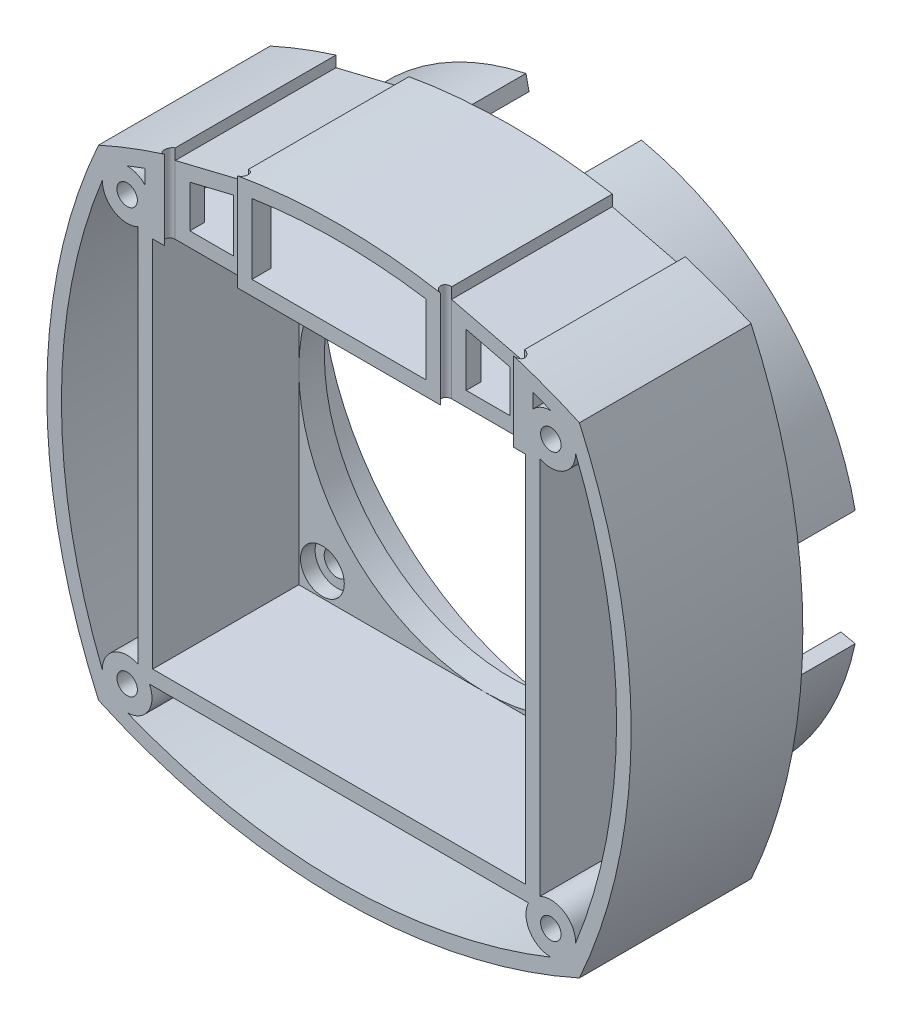
from build123d import *

# Parameters (mm, degrees)
EXTRUDE_1_DEPTH      = 23.5
SKETCH_4_R           = 25.5
CUT_EXTRUDE_1_DEPTH  = 3.5
SKETCH_5_W           = 51
SKETCH_5_H           = 51
CUT_EXTRUDE_2_DEPTH  = 20
SKETCH_7_R           = 3.000005628
SKETCH_7_R_2         = 3
CUT_EXTRUDE_4_DEPTH  = 2
SKETCH_8_R           = 1.75
CUT_EXTRUDE_5_DEPTH  = 2
SKETCH_10_R          = 1.4
CUT_EXTRUDE_6_DEPTH  = 8
EXTRUDE_2_DEPTH      = 10
CUT_EXTRUDE_7_DEPTH  = 56
CUT_EXTRUDE_START    = -26
CUT_EXTRUDE_8_DEPTH  = 26
SHELL_START          = -38
SHELL_1_OUTLINE_W    = 55
SHELL_1_OUTLINE_H    = 21.5
SHELL_1_DEPTH        = 10.5
SHELL_START_2        = 27.5
SHELL_1_2_DEPTH      = 8.20966081
SHELL_START_3        = 35.221916067
SHELL_1_3_DEPTH      = 2.778083933
SHELL_1_4_DEPTH      = 6.069092804
SHELL_START_4        = 2
SHELL_1_5_DEPTH      = 21.5
SHELL_1_6_DEPTH      = 11.5
SHELL_1_7_DEPTH      = 20
SHELL_START_5        = 13.5
SHELL_1_8_DEPTH      = 10
CUT_EXTRUDE_9_DEPTH  = 20
CUT_EXTRUDE_START_2  = -21.5
CUT_EXTRUDE_10_DEPTH = 21.5


with BuildPart() as part:
    # 草图3 → 凸台-拉伸1 (new body)
    with BuildSketch(Plane.XY):
        with BuildLine():
            ThreePointArc((32.915026221, 32.915026221), (0, 40), (-32.915026221, 32.915026221))
            ThreePointArc((-32.915026221, 32.915026221), (-40, 0), (-32.915026221, -32.915026221))
            ThreePointArc((-32.915026221, -32.915026221), (0, -40), (32.915026221, -32.915026221))
            ThreePointArc((32.915026221, -32.915026221), (40, 0), (32.915026221, 32.915026221))
        make_face()
    extrude(amount=EXTRUDE_1_DEPTH)

    # 草图4 → 切除-拉伸1 (cut)
    with BuildSketch(Plane(origin=(0, 0, 0), x_dir=(-1, 0, 0), z_dir=(0, 0, -1))):
        Circle(SKETCH_4_R)
    extrude(amount=-CUT_EXTRUDE_1_DEPTH, mode=Mode.SUBTRACT)

    # 草图5 → 切除-拉伸2 (cut)
    with BuildSketch(Plane.XY.offset(23.5)):
        Rectangle(SKETCH_5_W, SKETCH_5_H)
    extrude(amount=-CUT_EXTRUDE_2_DEPTH, mode=Mode.SUBTRACT)

    # 草图7 → 切除-拉伸4 (cut)
    with BuildSketch(Plane.XY.offset(3.5)):
        with Locations((22.273863607, -22.273863607)):
            Circle(SKETCH_7_R)
        with Locations((-22.273863607, -22.273863607)):
            Circle(SKETCH_7_R_2)
        with Locations((22.273863607, 22.273863607)):
            Circle(SKETCH_7_R_2)
        with Locations((-22.273863607, 22.273863607)):
            Circle(SKETCH_7_R_2)
    extrude(amount=-CUT_EXTRUDE_4_DEPTH, mode=Mode.SUBTRACT)

    # 草图8 → 切除-拉伸5 (cut)
    with BuildSketch(Plane.XY.offset(1.5)):
        with Locations((22.273863607, -22.273863607)):
            Circle(SKETCH_8_R)
        with Locations((-22.273863607, -22.273863607)):
            Circle(SKETCH_8_R)
        with Locations((22.273863607, 22.273863607)):
            Circle(SKETCH_8_R)
        with Locations((-22.273863607, 22.273863607)):
            Circle(SKETCH_8_R)
    extrude(amount=-CUT_EXTRUDE_5_DEPTH, mode=Mode.SUBTRACT)

    # 草图10 → 切除-拉伸6 (cut)
    with BuildSketch(Plane.XY.offset(23.5)):
        with Locations((29, -29)):
            Circle(SKETCH_10_R)
        with Locations((29, 29)):
            Circle(SKETCH_10_R)
        with Locations((-29, 29)):
            Circle(SKETCH_10_R)
        with Locations((-29, -29)):
            Circle(SKETCH_10_R)
    extrude(amount=-CUT_EXTRUDE_6_DEPTH, mode=Mode.SUBTRACT)

    # 草图11 → 凸台-拉伸2 (add)
    with BuildSketch(Plane(origin=(0, 0, 0), x_dir=(-1, 0, 0), z_dir=(0, 0, -1))):
        with BuildLine():
            Line((-7.900644251, 37.169608828), (-7.484820869, 35.213313626))
            ThreePointArc((-7.484820869, 35.213313626), (-25.455844123, 25.455844123), (-35.213313626, 7.484820869))
            Line((-35.213313626, 7.484820869), (-37.169608828, 7.900644251))
            ThreePointArc((-37.169608828, 7.900644251), (-26.870057685, 26.870057685), (-7.900644251, 37.169608828))
        make_face()
        with BuildLine():
            Line((7.900644251, 37.169608828), (7.484820869, 35.213313626))
            ThreePointArc((7.484820869, 35.213313626), (25.455844123, 25.455844123), (35.213313626, 7.484820869))
            Line((35.213313626, 7.484820869), (37.169608828, 7.900644251))
            ThreePointArc((37.169608828, 7.900644251), (26.870057685, 26.870057685), (7.900644251, 37.169608828))
        make_face()
        with BuildLine():
            Line((-35.213313626, -7.484820869), (-37.169608828, -7.900644251))
            ThreePointArc((-37.169608828, -7.900644251), (-26.870057685, -26.870057685), (-7.900644251, -37.169608828))
            Line((-7.900644251, -37.169608828), (-7.484820869, -35.213313626))
            ThreePointArc((-7.484820869, -35.213313626), (-25.455844123, -25.455844123), (-35.213313626, -7.484820869))
        make_face()
        with BuildLine():
            Line((7.484820869, -35.213313626), (7.900644251, -37.169608828))
            ThreePointArc((7.900644251, -37.169608828), (26.870057685, -26.870057685), (37.169608828, -7.900644251))
            Line((37.169608828, -7.900644251), (35.213313626, -7.484820869))
            ThreePointArc((35.213313626, -7.484820869), (25.455844123, -25.455844123), (7.484820869, -35.213313626))
        make_face()
    extrude(amount=EXTRUDE_2_DEPTH)

    # 草图12 → 切除-拉伸7 (cut)
    with BuildSketch(Plane(origin=(0, 0, 0), x_dir=(1, 0, 0), z_dir=(0, 1, 0))):
        with BuildLine():
            Line((-23.915026221, -23.5), (-13.915026221, -23.5))
            ThreePointArc((-13.915026221, -23.5), (-13.165026221, -22.75), (-13.915026221, -22))
            Line((-13.915026221, -22), (-23.915026221, -22))
            ThreePointArc((-23.915026221, -22), (-24.665026221, -22.75), (-23.915026221, -23.5))
        make_face()
        with BuildLine():
            Line((13.915026221, -23.5), (23.915026221, -23.5))
            ThreePointArc((23.915026221, -23.5), (24.665026221, -22.75), (23.915026221, -22))
            Line((23.915026221, -22), (13.915026221, -22))
            ThreePointArc((13.915026221, -22), (13.165026221, -22.75), (13.915026221, -23.5))
        make_face()
    extrude(amount=CUT_EXTRUDE_7_DEPTH, mode=Mode.SUBTRACT)

    # 草图13 → 切除-拉伸8 (cut)
    with BuildSketch(Plane.XY.offset(22).offset(CUT_EXTRUDE_START)):
        with BuildLine():
            Line((-23.915026221, 36.341807162), (-23.915026221, 34.841807162))
            Line((-23.915026221, 34.841807162), (-13.915026221, 37.280530877))
            Line((-13.915026221, 37.280530877), (-13.915026221, 38.780530877))
            ThreePointArc((-13.915026221, 38.780530877), (-18.954288704, 37.722165048), (-23.915026221, 36.341807162))
        make_face()
        with BuildLine():
            Line((13.915026221, 38.780530877), (13.915026221, 37.280530877))
            Line((13.915026221, 37.280530877), (23.915026221, 34.841807162))
            Line((23.915026221, 34.841807162), (23.915026221, 36.341807162))
            ThreePointArc((23.915026221, 36.341807162), (18.954288704, 37.722165048), (13.915026221, 38.780530877))
        make_face()
    extrude(amount=CUT_EXTRUDE_8_DEPTH, mode=Mode.SUBTRACT)

    # 抽壳1: read off the stored shape, not the designer's step
    # 抽壳1 outline → 抽壳1 (cut)
    with BuildSketch(Plane(origin=(0, 0, 0), x_dir=(1, 0, 0), z_dir=(0, 1, 0)).offset(SHELL_START)):
        with Locations((0, -12.75)):
            Rectangle(SHELL_1_OUTLINE_W, SHELL_1_OUTLINE_H)
    extrude(amount=SHELL_1_DEPTH, mode=Mode.SUBTRACT)

    # Shell 1 2 outline → Shell 1 2 (cut)
    with BuildSketch(Plane(origin=(0, 0, 0), x_dir=(1, 0, 0), z_dir=(0, 1, 0)).offset(SHELL_START_2)):
        with BuildLine():
            Line((-25.915026221, -2), (-25.915026221, -13.5))
            Line((-25.915026221, -13.5), (-25.915026221, -20.862541391))
            ThreePointArc((-25.915026221, -20.862541391), (-25.004059927, -20.224825632), (-23.915026221, -20))
            Line((-23.915026221, -20), (-13.915026221, -20))
            ThreePointArc((-13.915026221, -20), (-12.47888556, -20.40479212), (-11.465536479, -21.5))
            Line((-11.465536479, -21.5), (11.465536479, -21.5))
            ThreePointArc((11.465536479, -21.5), (12.47888556, -20.40479212), (13.915026221, -20))
            Line((13.915026221, -20), (23.915026221, -20))
            ThreePointArc((23.915026221, -20), (25.004059927, -20.224825632), (25.915026221, -20.862541391))
            Line((25.915026221, -20.862541391), (25.915026221, -13.5))
            Line((25.915026221, -13.5), (25.915026221, -2))
            Line((25.915026221, -2), (-25.915026221, -2))
        make_face()
    extrude(amount=SHELL_1_2_DEPTH, mode=Mode.SUBTRACT)

    # Shell 1 3 outline → Shell 1 3 (cut)
    with BuildSketch(Plane(origin=(0, 0, 0), x_dir=(1, 0, 0), z_dir=(0, 1, 0)).offset(SHELL_START_3)):
        with BuildLine():
            Line((11.915026221, -2), (-11.915026221, -2))
            Line((-11.915026221, -2), (-11.915026221, -20.862541391))
            ThreePointArc((-11.915026221, -20.862541391), (-11.667565852, -21.165253368), (-11.465536479, -21.5))
            Line((-11.465536479, -21.5), (11.465536479, -21.5))
            ThreePointArc((11.465536479, -21.5), (11.667565852, -21.165253368), (11.915026221, -20.862541391))
            Line((11.915026221, -20.862541391), (11.915026221, -2))
        make_face()
    extrude(amount=SHELL_1_3_DEPTH, mode=Mode.SUBTRACT)

    # Shell 1 4 outline → Shell 1 4 (cut)
    with BuildSketch(Plane(origin=(0, 0, 0), x_dir=(1, 0, 0), z_dir=(0, 1, 0)).offset(SHELL_START_2)):
        with BuildLine():
            Line((-25.915026221, -2), (-27.5, -2))
            Line((-27.5, -2), (-27.5, -23.5))
            Line((-27.5, -23.5), (-26.560777532, -23.5))
            ThreePointArc((-26.560777532, -23.5), (-26.586130541, -22.096010925), (-25.915026221, -20.862541391))
            Line((-25.915026221, -20.862541391), (-25.915026221, -2))
        make_face()
        with BuildLine():
            Line((27.5, -2), (25.915026221, -2))
            Line((25.915026221, -2), (25.915026221, -20.862541391))
            ThreePointArc((25.915026221, -20.862541391), (26.586130541, -22.096010925), (26.560777532, -23.5))
            Line((26.560777532, -23.5), (27.5, -23.5))
            Line((27.5, -23.5), (27.5, -2))
        make_face()
    extrude(amount=SHELL_1_4_DEPTH, mode=Mode.SUBTRACT)

    # Shell 1 5 outline → Shell 1 5 (cut)
    with BuildSketch(Plane.XY.offset(SHELL_START_4)):
        with BuildLine():
            Line((27.5, -32.051229261), (27.5, -32.991437854))
            ThreePointArc((27.5, -32.991437854), (28.262318347, -32.699665486), (29.02154168, -32.399931758))
            ThreePointArc((29.02154168, -32.399931758), (28.240488243, -32.314082361), (27.5, -32.051229261))
        make_face()
        with BuildLine():
            ThreePointArc((-29.02154168, -32.399931758), (-28.262318347, -32.699665486), (-27.5, -32.991437854))
            Line((-27.5, -32.991437854), (-27.5, -32.051229261))
            ThreePointArc((-27.5, -32.051229261), (-28.240488243, -32.314082361), (-29.02154168, -32.399931758))
        make_face()
        with BuildLine():
            ThreePointArc((27.5, -25.94877074), (30.806354197, -26.119533976), (32.399931758, -29.02154168))
            ThreePointArc((32.399931758, -29.02154168), (38, 0), (32.399931758, 29.02154168))
            ThreePointArc((32.399931758, 29.02154168), (30.806354197, 26.119533976), (27.5, 25.94877074))
            Line((27.5, 25.94877074), (27.5, -25.94877074))
        make_face()
        with BuildLine():
            ThreePointArc((-32.399931758, 29.02154168), (-38, 0), (-32.399931758, -29.02154168))
            ThreePointArc((-32.399931758, -29.02154168), (-30.806354197, -26.119533976), (-27.5, -25.94877074))
            Line((-27.5, -25.94877074), (-27.5, 25.94877074))
            ThreePointArc((-27.5, 25.94877074), (-30.806354197, 26.119533976), (-32.399931758, 29.02154168))
        make_face()
        with BuildLine():
            ThreePointArc((27.5, 32.051229261), (28.240488243, 32.314082361), (29.02154168, 32.399931758))
            ThreePointArc((29.02154168, 32.399931758), (28.262318347, 32.699665486), (27.5, 32.991437854))
            Line((27.5, 32.991437854), (27.5, 32.051229261))
        make_face()
        with BuildLine():
            ThreePointArc((-27.5, 32.991437854), (-28.262318347, 32.699665485), (-29.02154168, 32.399931757))
            ThreePointArc((-29.02154168, 32.399931757), (-28.240488243, 32.314082361), (-27.5, 32.051229261))
            Line((-27.5, 32.051229261), (-27.5, 32.991437854))
        make_face()
    extrude(amount=SHELL_1_5_DEPTH, mode=Mode.SUBTRACT)

    # Shell 1 6 outline → Shell 1 6 (cut)
    with BuildSketch(Plane.XY.offset(SHELL_START_4)):
        with BuildLine():
            ThreePointArc((27.5, -32.051229261), (28.240488243, -32.314082361), (29.02154168, -32.399931758))
            ThreePointArc((29.02154168, -32.399931758), (30.215098896, -31.909997906), (31.400389104, -31.400389104))
            ThreePointArc((31.400389104, -31.400389104), (31.909997906, -30.215098896), (32.399931758, -29.02154168))
            ThreePointArc((32.399931758, -29.02154168), (30.806354197, -26.119533976), (27.5, -25.94877074))
            Line((27.5, -25.94877074), (27.5, -32.051229261))
        make_face()
        with BuildLine():
            ThreePointArc((-31.400389104, -31.400389104), (-30.215098896, -31.909997906), (-29.02154168, -32.399931758))
            ThreePointArc((-29.02154168, -32.399931758), (-28.240488243, -32.314082361), (-27.5, -32.051229261))
            Line((-27.5, -32.051229261), (-27.5, -25.94877074))
            ThreePointArc((-27.5, -25.94877074), (-30.806354197, -26.119533976), (-32.399931758, -29.02154168))
            ThreePointArc((-32.399931758, -29.02154168), (-31.909997906, -30.215098896), (-31.400389104, -31.400389104))
        make_face()
        with BuildLine():
            ThreePointArc((27.5, 25.94877074), (30.806354197, 26.119533976), (32.399931758, 29.02154168))
            ThreePointArc((32.399931758, 29.02154168), (31.909997906, 30.215098896), (31.400389104, 31.400389104))
            ThreePointArc((31.400389104, 31.400389104), (30.215098896, 31.909997906), (29.02154168, 32.399931758))
            ThreePointArc((29.02154168, 32.399931758), (28.240488243, 32.314082361), (27.5, 32.051229261))
            Line((27.5, 32.051229261), (27.5, 25.94877074))
        make_face()
        with BuildLine():
            ThreePointArc((-31.400389104, 31.400389104), (-31.909997906, 30.215098896), (-32.399931758, 29.02154168))
            ThreePointArc((-32.399931758, 29.02154168), (-30.806354197, 26.119533976), (-27.5, 25.94877074))
            Line((-27.5, 25.94877074), (-27.5, 32.051229261))
            ThreePointArc((-27.5, 32.051229261), (-28.240488243, 32.314082361), (-29.02154168, 32.399931758))
            ThreePointArc((-29.02154168, 32.399931758), (-30.215098896, 31.909997905), (-31.400389104, 31.400389104))
        make_face()
    extrude(amount=SHELL_1_6_DEPTH, mode=Mode.SUBTRACT)

    # Shell 1 7 outline → Shell 1 7 (add)
    with BuildSketch(Plane.XY.offset(SHELL_START_4)):
        with BuildLine():
            ThreePointArc((17.776388835, -38), (22.683791619, -36.71665789), (27.5, -35.124896006))
            Line((27.5, -35.124896006), (27.5, -32.991437854))
            ThreePointArc((27.5, -32.991437854), (13.976191293, -36.737644458), (-4.6e-08, -38))
            Line((-4.6e-08, -38), (17.776388835, -38))
        make_face()
        with BuildLine():
            ThreePointArc((-27.5, -35.124896006), (-22.683791619, -36.71665789), (-17.776388835, -38))
            Line((-17.776388835, -38), (-4.6e-08, -38))
            ThreePointArc((-4.6e-08, -38), (-13.976191338, -36.73764445), (-27.5, -32.991437854))
            Line((-27.5, -32.991437854), (-27.5, -35.124896006))
        make_face()
        with BuildLine():
            ThreePointArc((25.915026221, 33.569092804), (26.709074822, 33.284550365), (27.5, 32.991437854))
            Line((27.5, 32.991437854), (27.5, 33.569092804))
            Line((27.5, 33.569092804), (25.915026221, 33.569092804))
        make_face()
        with BuildLine():
            Line((25.915026221, 32.29544761), (25.915026221, 33.569092804))
            Line((25.915026221, 33.569092804), (25.915026221, 35.686269666))
            ThreePointArc((25.915026221, 35.686269666), (25.880820865, 35.697972967), (25.846610223, 35.70966081))
            Line((25.846610223, 35.70966081), (23.915026221, 35.70966081))
            Line((23.915026221, 35.70966081), (23.915026221, 34.841807162))
            Line((23.915026221, 34.841807162), (20.356387568, 35.70966081))
            Line((20.356387568, 35.70966081), (11.915026221, 35.70966081))
            Line((11.915026221, 35.70966081), (25.915026221, 32.29544761))
        make_face()
        with BuildLine():
            Line((-27.5, 33.569092804), (-27.5, 32.991437854))
            ThreePointArc((-27.5, 32.991437854), (-26.709073072, 33.284551002), (-25.915022708, 33.569094041))
            Line((-25.915022708, 33.569094041), (-27.5, 33.569092804))
        make_face()
        with BuildLine():
            Line((-25.915026221, 35.686269666), (-25.915026221, 33.569092804))
            Line((-25.915026221, 33.569092804), (-25.915026221, 32.29544761))
            Line((-25.915026221, 32.29544761), (-11.915026221, 35.70966081))
            Line((-11.915026221, 35.70966081), (-20.356387568, 35.70966081))
            Line((-20.356387568, 35.70966081), (-23.915026221, 34.841807162))
            Line((-23.915026221, 34.841807162), (-23.915026221, 35.70966081))
            Line((-23.915026221, 35.70966081), (-25.846610223, 35.70966081))
            ThreePointArc((-25.846610223, 35.70966081), (-25.880820865, 35.697972967), (-25.915026221, 35.686269666))
        make_face()
        with BuildLine():
            ThreePointArc((0, 38), (5.97507003, 37.77080775), (11.915026221, 37.084577901))
            Line((11.915026221, 37.084577901), (11.915026221, 38))
            Line((11.915026221, 38), (0, 38))
        make_face()
        with BuildLine():
            ThreePointArc((-11.915026221, 37.084577901), (-5.97507003, 37.77080775), (0, 38))
            Line((0, 38), (-11.915026221, 38))
            Line((-11.915026221, 38), (-11.915026221, 37.084577901))
        make_face()
    extrude(amount=SHELL_1_7_DEPTH)

    # Shell 1 8 outline → Shell 1 8 (add)
    with BuildSketch(Plane.XY.offset(SHELL_START_5)):
        with BuildLine():
            ThreePointArc((17.776388835, -38), (22.683791619, -36.71665789), (27.5, -35.124896006))
            Line((27.5, -35.124896006), (27.5, -32.991437854))
            ThreePointArc((27.5, -32.991437854), (13.976191293, -36.737644458), (-4.6e-08, -38))
            Line((-4.6e-08, -38), (17.776388835, -38))
        make_face()
        with BuildLine():
            ThreePointArc((-27.5, -35.124896006), (-22.683791619, -36.71665789), (-17.776388835, -38))
            Line((-17.776388835, -38), (-4.6e-08, -38))
            ThreePointArc((-4.6e-08, -38), (-13.976191338, -36.73764445), (-27.5, -32.991437854))
            Line((-27.5, -32.991437854), (-27.5, -35.124896006))
        make_face()
        with BuildLine():
            ThreePointArc((25.94877074, -27.5), (25.781794927, -30.096884729), (27.5, -32.051229261))
            Line((27.5, -32.051229261), (27.5, -27.5))
            Line((27.5, -27.5), (25.94877074, -27.5))
        make_face()
        with BuildLine():
            Line((-27.5, -27.5), (-27.5, -32.051229261))
            ThreePointArc((-27.5, -32.051229261), (-25.781794927, -30.096884729), (-25.94877074, -27.5))
            Line((-25.94877074, -27.5), (-27.5, -27.5))
        make_face()
        with BuildLine():
            Line((25.94877074, 27.5), (27.5, 27.5))
            Line((27.5, 27.5), (27.5, 32.051229261))
            ThreePointArc((27.5, 32.051229261), (25.781794927, 30.096884729), (25.94877074, 27.5))
        make_face()
        with BuildLine():
            Line((-27.5, 32.051229261), (-27.5, 27.5))
            Line((-27.5, 27.5), (-25.94877074, 27.5))
            ThreePointArc((-25.94877074, 27.5), (-25.781794927, 30.096884729), (-27.5, 32.051229261))
        make_face()
        with BuildLine():
            ThreePointArc((25.915026221, 33.569092804), (26.709074822, 33.284550365), (27.5, 32.991437854))
            Line((27.5, 32.991437854), (27.5, 33.569092804))
            Line((27.5, 33.569092804), (25.915026221, 33.569092804))
        make_face()
        with BuildLine():
            Line((-27.5, 33.569092804), (-27.5, 32.991437854))
            ThreePointArc((-27.5, 32.991437854), (-26.709073072, 33.284551002), (-25.915022708, 33.569094041))
            Line((-25.915022708, 33.569094041), (-27.5, 33.569092804))
        make_face()
    extrude(amount=SHELL_1_8_DEPTH)

    # 草图15 → 切除-拉伸9 (cut)
    with BuildSketch(Plane.XY.offset(22)):
        Polygon((21.915026221, 33.270937096), (15.915026221, 34.734171325), (15.915026221, 27.5), (21.915026221, 27.5), align=None)
        Polygon((-15.915026221, 34.734171325), (-21.915026221, 33.270937096), (-21.915026221, 27.5), (-15.915026221, 27.5), align=None)
    extrude(amount=-CUT_EXTRUDE_9_DEPTH, mode=Mode.SUBTRACT)

    # 草图16 → 切除-拉伸10 (cut)
    with BuildSketch(Plane.XY.offset(23.5).offset(CUT_EXTRUDE_START_2)):
        with BuildLine():
            Line((-11.915026221, 37.084577901), (-11.915026221, 27.5))
            Line((-11.915026221, 27.5), (11.915026221, 27.5))
            Line((11.915026221, 27.5), (11.915026221, 37.084577901))
            ThreePointArc((11.915026221, 37.084577901), (0, 38), (-11.915026221, 37.084577901))
        make_face()
    extrude(amount=CUT_EXTRUDE_10_DEPTH, mode=Mode.SUBTRACT)


solid = part.part
